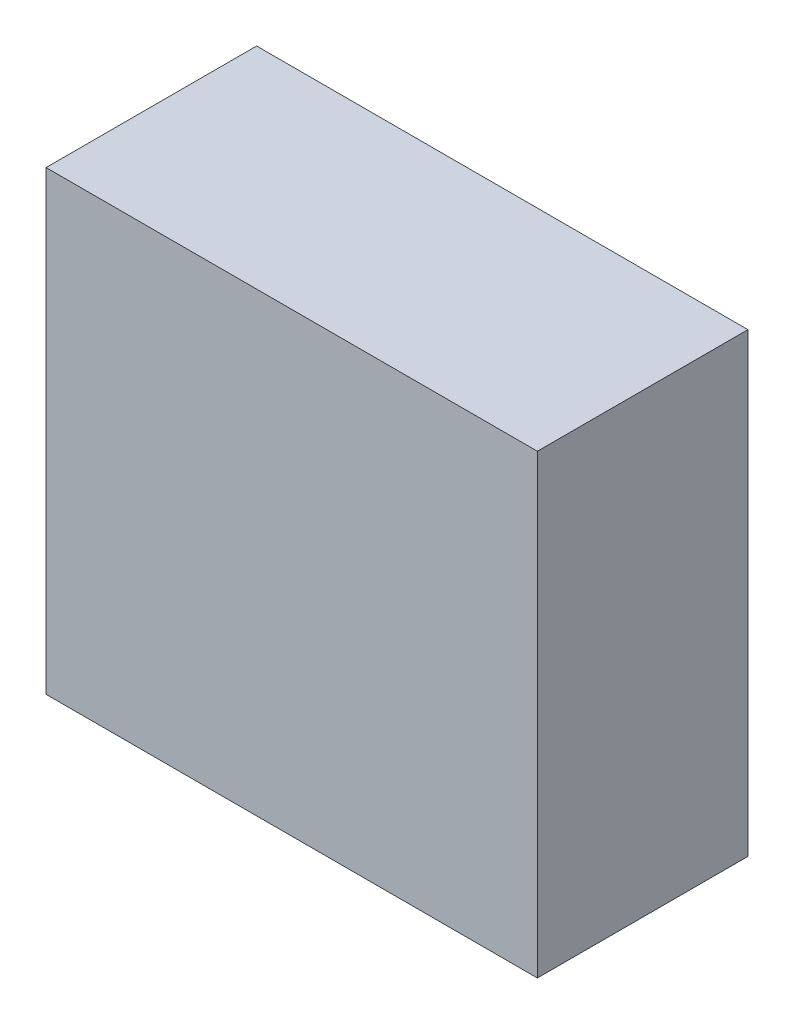
from build123d import *

# Parameters (mm, degrees)
SKETCH2_W           = 177.8
SKETCH2_H           = 165.1
BOSS_EXTRUDE1_DEPTH = 76.2


with BuildPart() as part:
    # Sketch2 → Boss-Extrude1 (new body)
    with BuildSketch(Plane.XY):
        Rectangle(SKETCH2_W, SKETCH2_H)
    extrude(amount=BOSS_EXTRUDE1_DEPTH)


solid = part.part
